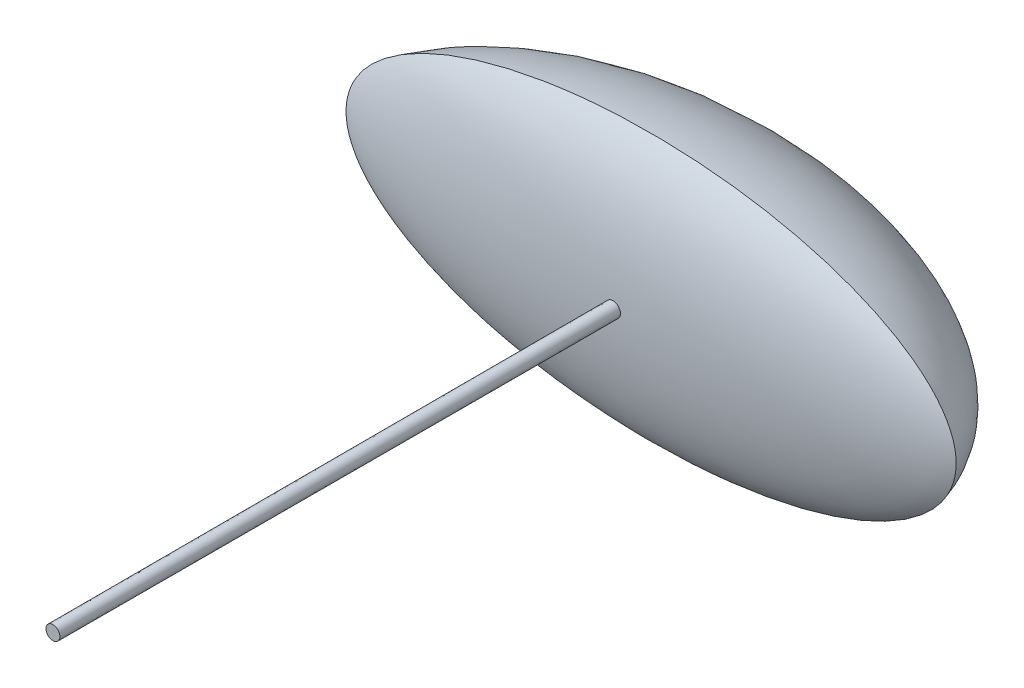
from build123d import *

# Parameters (mm, degrees)
BEAM_SCALE_X   = 1
BEAM_SCALE_Y   = 3.5
BEAM_SCALE_Z   = 1
LENGTH_SCALE_X = 8
LENGTH_SCALE_Y = 1
LENGTH_SCALE_Z = 1
MAST_START     = -101.6
SKETCH11_R     = 5.08
MAST_DEPTH     = 500
MAST_TAPER     = 0.05


with BuildPart() as part:
    # YZ Section_depthOnly → Depth (revolve)
    with BuildSketch(Plane(origin=(0, 0, 0), x_dir=(0, 0, -1), z_dir=(1, 0, 0))):
        with BuildLine():
            Line((0, 0), (0, -25.4))
            add(Edge.make_bspline(
                [(0, -25.4), (101.6, -21.166666667), (101.6, 0)],
                knots=[4.913746901, 4.913746901, 4.913746901, 6.283185307, 6.283185307, 6.283185307], degree=2, weights=[1, 0.774596669, 1]))
            Line((101.6, 0), (0, 0))
        make_face()
    revolve(axis=Axis((0, 0, 25.4), (0, 0, -1)))

    # Sketch13 → Revolve1 (revolve)
    with BuildSketch(Plane(origin=(0, 0, 0), x_dir=(0, 0, -1), z_dir=(1, 0, 0))):
        with BuildLine():
            Line((0, -25.4), (0, 0))
            Line((0, 0), (-25.4, 0))
            add(Edge.make_bspline(
                [(-25.4, 0), (-25.4, -19.05), (0, -25.4)],
                knots=[0, 0, 0, 1.230959417, 1.230959417, 1.230959417], degree=2, weights=[1, 0.816496581, 1]))
        make_face()
    revolve(axis=Axis((0, 0, 0), (0, 0, 1)))


with BuildPart() as part_1:
    # Beam: scaled about (0, 0, 0)
    add(part.part.scale((BEAM_SCALE_X, BEAM_SCALE_Y, BEAM_SCALE_Z), about=(0, 0, 0)))


with BuildPart() as part_2:
    # Length: scaled about (0, 0, 0)
    add(part_1.part.scale((LENGTH_SCALE_X, LENGTH_SCALE_Y, LENGTH_SCALE_Z), about=(0, 0, 0)))

    # Sketch11 → Mast (add)
    with BuildSketch(Plane.XY.offset(MAST_START)):
        Circle(SKETCH11_R)
    extrude(amount=MAST_DEPTH, taper=MAST_TAPER)


solid = part_2.part
